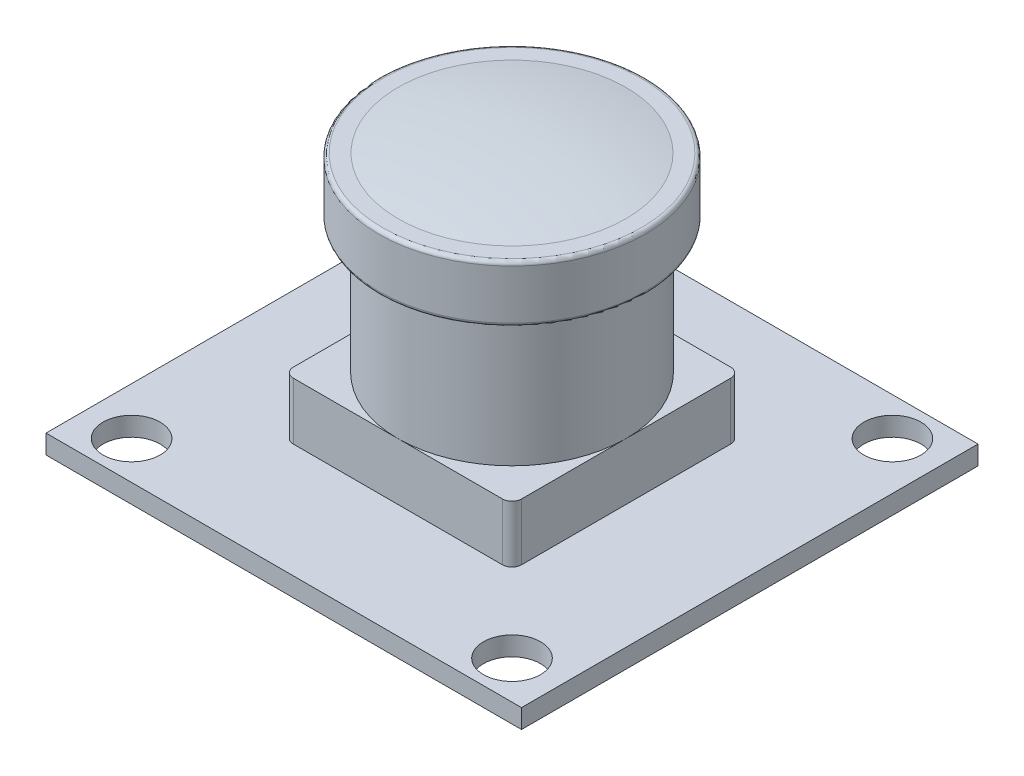
from build123d import *

# Parameters (mm, degrees)
SKETCH_1_W          = 25
SKETCH_1_H          = 24
EXTRUDE_1_DEPTH     = 1
SKETCH_2_W          = 12
SKETCH_2_H          = 12
EXTRUDE_2_DEPTH     = 3
SKETCH_3_R          = 6
EXTRUDE_3_DEPTH     = 7
SKETCH_4_R          = 7
EXTRUDE_4_DEPTH     = 3
FILLET_1_R          = 0.2
FILLET_2_R          = 0.5
CUT_EXTRUDE_1_REACH = 24.625
SKETCH_6_R          = 1.5


with BuildPart() as part:
    # 草图1 → 凸台-拉伸1 (new body)
    with BuildSketch(Plane(origin=(0, 0, 0), x_dir=(1, 0, 0), z_dir=(0, 1, 0))):
        Rectangle(SKETCH_1_W, SKETCH_1_H)
    extrude(amount=EXTRUDE_1_DEPTH)

    # 草图2 → 凸台-拉伸2 (add)
    with BuildSketch(Plane(origin=(0, 1, 0), x_dir=(1, 0, 0), z_dir=(0, 1, 0))):
        Rectangle(SKETCH_2_W, SKETCH_2_H)
    extrude(amount=EXTRUDE_2_DEPTH)

    # 草图3 → 凸台-拉伸3 (add)
    with BuildSketch(Plane(origin=(0, 4, 0), x_dir=(1, 0, 0), z_dir=(0, 1, 0))):
        Circle(SKETCH_3_R)
    extrude(amount=EXTRUDE_3_DEPTH)

    # 草图4 → 凸台-拉伸4 (add)
    with BuildSketch(Plane(origin=(0, 11, 0), x_dir=(1, 0, 0), z_dir=(0, 1, 0))):
        Circle(SKETCH_4_R)
    extrude(amount=EXTRUDE_4_DEPTH)

    # 草图5 → 旋转1 (revolve)
    with BuildSketch(Plane.XY):
        with BuildLine():
            Line((-5.986651819, 14), (0, 14))
            Line((0, 14), (0, 14.54757328))
            ThreePointArc((0, 14.54757328), (-3.005820874, 14.41039484), (-5.986651819, 14))
        make_face()
    revolve(axis=Axis((0, 14, 0), (0, 1, 0)))

    # 圆角1
    fillet_1_edges = [part.edges().sort_by_distance(p)[0] for p in [
        (-7, 11, 0),
        (-7, 14, 0),
    ]]
    fillet(fillet_1_edges, radius=FILLET_1_R)

    # 圆角2
    fillet_2_edges = [part.edges().sort_by_distance(p)[0] for p in [
        (6, 2.5, 6),
        (6, 2.5, -6),
        (-6, 2.5, -6),
        (-6, 2.5, 6),
    ]]
    fillet(fillet_2_edges, radius=FILLET_2_R)

    # 草图6 → 切除-拉伸1 (cut, up to next)
    with BuildSketch(Plane.XZ, mode=Mode.PRIVATE) as cut_extrude_1_sk1:
        with Locations((-10, 10)):
            Circle(SKETCH_6_R)
    cut_extrude_1_tool1 = extrude(cut_extrude_1_sk1.sketch, amount=-CUT_EXTRUDE_1_REACH, mode=Mode.PRIVATE) & part.part
    # 草图6 → 切除-拉伸1 (cut, up to next)
    with BuildSketch(Plane.XZ, mode=Mode.PRIVATE) as cut_extrude_1_sk2:
        with Locations((10, 10)):
            Circle(SKETCH_6_R)
    cut_extrude_1_tool2 = extrude(cut_extrude_1_sk2.sketch, amount=-CUT_EXTRUDE_1_REACH, mode=Mode.PRIVATE) & part.part
    # 草图6 → 切除-拉伸1 (cut, up to next)
    with BuildSketch(Plane.XZ, mode=Mode.PRIVATE) as cut_extrude_1_sk3:
        with Locations((-10, -10)):
            Circle(SKETCH_6_R)
    cut_extrude_1_tool3 = extrude(cut_extrude_1_sk3.sketch, amount=-CUT_EXTRUDE_1_REACH, mode=Mode.PRIVATE) & part.part
    # 草图6 → 切除-拉伸1 (cut, up to next)
    with BuildSketch(Plane.XZ, mode=Mode.PRIVATE) as cut_extrude_1_sk4:
        with Locations((10, -10)):
            Circle(SKETCH_6_R)
    cut_extrude_1_tool4 = extrude(cut_extrude_1_sk4.sketch, amount=-CUT_EXTRUDE_1_REACH, mode=Mode.PRIVATE) & part.part
    add(cut_extrude_1_tool1.solids().sort_by_distance((-10, 0, 10))[0], mode=Mode.SUBTRACT)
    add(cut_extrude_1_tool2.solids().sort_by_distance((10, 0, 10))[0], mode=Mode.SUBTRACT)
    add(cut_extrude_1_tool3.solids().sort_by_distance((-10, 0, -10))[0], mode=Mode.SUBTRACT)
    add(cut_extrude_1_tool4.solids().sort_by_distance((10, 0, -10))[0], mode=Mode.SUBTRACT)


solid = part.part
